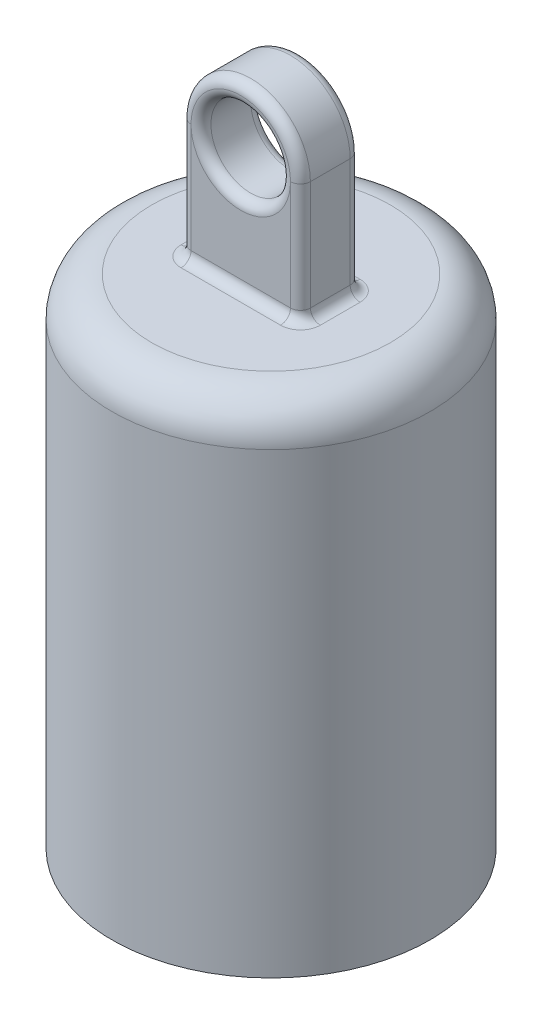
from build123d import *

# Parameters (mm, degrees)
SKETCH_1_R          = 2
EXTRUDE_1_DEPTH     = 1.5
SKETCH_2_R          = 8
EXTRUDE_2_DEPTH     = 25
SKETCH_3_R          = 1.5
CUT_EXTRUDE_1_DEPTH = 2
SKETCH_4_R          = 6
CUT_EXTRUDE_2_DEPTH = 20
FILLET_5_R          = 0.5
FILLET_6_R          = 2


with BuildPart() as part:
    # 草图1 → 凸台-拉伸1 (new, symmetric)
    with BuildSketch(Plane.XY):
        with BuildLine():
            Line((0, 0), (6, 0))
            Line((6, 0), (6, 6))
            ThreePointArc((6, 6), (3, 9), (0, 6))
            Line((0, 6), (0, 0))
        make_face()
        with Locations((3, 6)):
            Circle(SKETCH_1_R, mode=Mode.SUBTRACT)
    extrude(amount=EXTRUDE_1_DEPTH, both=True)

    # 草图2 → 凸台-拉伸2 (add)
    with BuildSketch(Plane.XZ):
        with Locations(Location((3.022849102, 0, 0), (0, 0, 270))):
            Circle(SKETCH_2_R)
    extrude(amount=EXTRUDE_2_DEPTH)

    # 草图3 → 切除-拉伸1 (cut)
    with BuildSketch(Plane.XZ.offset(25)):
        with Locations(Location((2.994848376, 0, 0), (0, 0, 270))):
            Circle(SKETCH_3_R)
    extrude(amount=-CUT_EXTRUDE_1_DEPTH, mode=Mode.SUBTRACT)

    # 草图4 → 切除-拉伸2 (cut)
    with BuildSketch(Plane.XZ.offset(23)):
        with Locations(Location((2.994848376, 0, 0), (0, 0, 270))):
            Circle(SKETCH_4_R)
    extrude(amount=-CUT_EXTRUDE_2_DEPTH, mode=Mode.SUBTRACT)

    # 圆角5
    fillet_5_edges = [part.edges().sort_by_distance(p)[0] for p in [
        (6, 3, 1.5),
        (1, 6, -1.5),
        (1, 6, 1.5),
        (3, 9, 1.5),
        (0, 3, 1.5),
        (3, 9, -1.5),
        (6, 3, -1.5),
        (3, 0, -1.5),
        (0, 3, -1.5),
        (3, 0, 1.5),
        (6, 0, 0),
        (0, 0, 0),
    ]]
    fillet(fillet_5_edges, radius=FILLET_5_R - 0.0001)  # a hair under: the kernel refuses the full size

    # 圆角6
    fillet_6_edges = [part.edges().sort_by_distance(p)[0] for p in [
        (3.022849102, 0, 8),
    ]]
    fillet(fillet_6_edges, radius=FILLET_6_R)


solid = part.part
